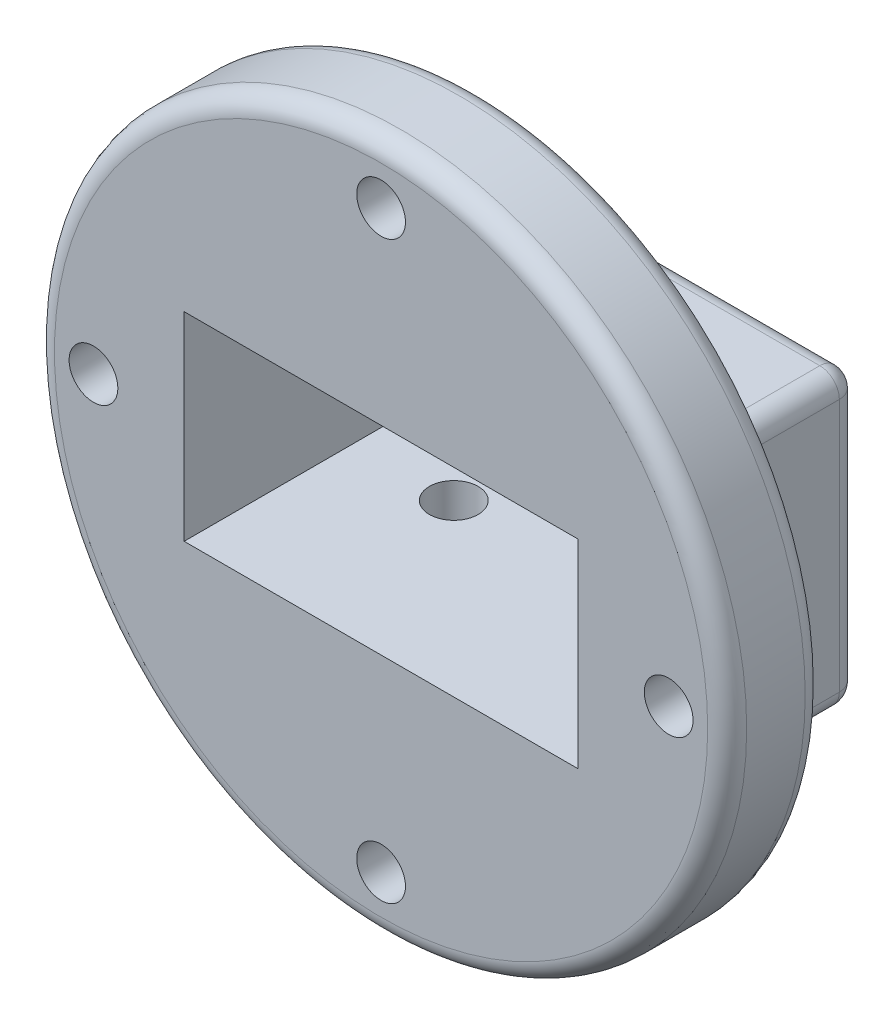
from build123d import *

# Parameters (mm, degrees)
SKETCH_1_R          = 35.5
SKETCH_1_W          = 40.4
SKETCH_1_H          = 20.4
SKETCH_1_R_2        = 2.5
EXTRUDE_1_DEPTH     = 10
EXTRUDE_2_DEPTH     = 15
FILLET_1_R          = 2
SKETCH_3_R          = 2.5
CUT_EXTRUDE_1_DEPTH = 64.525585397
FILLET_2_R          = 2


with BuildPart() as part:
    # 草图1 → 凸台-拉伸1 (new body)
    with BuildSketch(Plane.XY):
        Circle(SKETCH_1_R)
        Rectangle(SKETCH_1_W, SKETCH_1_H, mode=Mode.SUBTRACT)
        with Locations((29.5, 0)):
            Circle(SKETCH_1_R_2, mode=Mode.SUBTRACT)
        with Locations((0, 29.5)):
            Circle(SKETCH_1_R_2, mode=Mode.SUBTRACT)
        with Locations((-29.5, 0)):
            Circle(SKETCH_1_R_2, mode=Mode.SUBTRACT)
        with Locations((0, -29.5)):
            Circle(SKETCH_1_R_2, mode=Mode.SUBTRACT)
    extrude(amount=EXTRUDE_1_DEPTH)

    # 草图1<5> → 凸台-拉伸2 (add)
    # profile 1 of 3: a face of its own
    with BuildSketch(Plane.XY):
        with BuildLine():
            Line((18.090052515, 15), (0, 15))
            Line((0, 15), (-18.090052515, 15))
            ThreePointArc((-18.090052515, 15), (-23.5, 0), (-18.090052515, -15))
            Line((-18.090052515, -15), (18.090052515, -15))
            ThreePointArc((18.090052515, -15), (22.106178255, -7.97288423), (23.5, 0))
            ThreePointArc((23.5, 0), (22.106178255, 7.97288423), (18.090052515, 15))
        make_face()
        Polygon((-20.2, -10.2), (-20.2, 0), (-20.2, 10.2), (0, 10.2), (20.2, 10.2), (20.2, 0), (20.2, -10.2), align=None, mode=Mode.SUBTRACT)
    # profile 2 of 3: a face of its own
    with BuildSketch(Plane.XY):
        with BuildLine():
            Line((24, 15), (18.090052515, 15))
            ThreePointArc((18.090052515, 15), (22.106178255, 7.97288423), (23.5, 0))
            ThreePointArc((23.5, 0), (22.106178255, -7.97288423), (18.090052515, -15))
            Line((18.090052515, -15), (24, -15))
            Line((24, -15), (24, 15))
        make_face()
    # profile 3 of 3: a face of its own
    with BuildSketch(Plane.XY):
        with BuildLine():
            ThreePointArc((-18.090052515, -15), (-23.5, 0), (-18.090052515, 15))
            Line((-18.090052515, 15), (-24, 15))
            Line((-24, 15), (-24, -15))
            Line((-24, -15), (-18.090052515, -15))
        make_face()
    extrude(amount=-EXTRUDE_2_DEPTH)

    # 圆角1
    # the kernel refuses this fillet: 2 mm, written as the material it takes off along each edge
    with BuildSketch(Plane(origin=(-22, 13, -13), x_dir=(0, 1, 0), z_dir=(-1, 0, 0))) as fillet_1_piece_1_section:
        Polygon((0, 0), (FILLET_1_R, 0), (FILLET_1_R, FILLET_1_R), (0, FILLET_1_R), align=None)
    fillet_1_piece_1 = extrude(amount=FILLET_1_R, mode=Mode.PRIVATE)
    fillet_1_piece_1 = fillet_1_piece_1 - Plane(origin=(-22, 13, -13), x_dir=(0, -0.7071067811865475, 0.7071067811865475), z_dir=(-1, 0, 0)) * Sphere(FILLET_1_R, mode=Mode.PRIVATE)
    add(fillet_1_piece_1, mode=Mode.SUBTRACT)
    with BuildSketch(Plane(origin=(22, 13, -13), x_dir=(1, 0, 0), z_dir=(0, 1, 0))) as fillet_1_piece_2_section:
        Polygon((0, 0), (FILLET_1_R, 0), (FILLET_1_R, FILLET_1_R), (0, FILLET_1_R), align=None)
    fillet_1_piece_2 = extrude(amount=FILLET_1_R, mode=Mode.PRIVATE)
    fillet_1_piece_2 = fillet_1_piece_2 - Plane(origin=(22, 13, -13), x_dir=(-0.7071067811865475, 0, 0.7071067811865475), z_dir=(0, 1, 0)) * Sphere(FILLET_1_R, mode=Mode.PRIVATE)
    add(fillet_1_piece_2, mode=Mode.SUBTRACT)
    with BuildSketch(Plane(origin=(22, -13, -13), x_dir=(0, -1, 0), z_dir=(1, 0, 0))) as fillet_1_piece_3_section:
        Polygon((0, 0), (FILLET_1_R, 0), (FILLET_1_R, FILLET_1_R), (0, FILLET_1_R), align=None)
    fillet_1_piece_3 = extrude(amount=FILLET_1_R, mode=Mode.PRIVATE)
    fillet_1_piece_3 = fillet_1_piece_3 - Plane(origin=(22, -13, -13), x_dir=(0, 0.7071067811865475, 0.7071067811865475), z_dir=(1, 0, 0)) * Sphere(FILLET_1_R, mode=Mode.PRIVATE)
    add(fillet_1_piece_3, mode=Mode.SUBTRACT)
    with BuildSketch(Plane(origin=(-22, -13, -13), x_dir=(0, -1, 0), z_dir=(-1, 0, 0))) as fillet_1_piece_4_section:
        Polygon((0, 0), (FILLET_1_R, 0), (FILLET_1_R, -FILLET_1_R), (0, -FILLET_1_R), align=None)
    fillet_1_piece_4 = extrude(amount=FILLET_1_R, mode=Mode.PRIVATE)
    fillet_1_piece_4 = fillet_1_piece_4 - Plane(origin=(-22, -13, -13), x_dir=(0, 0.7071067811865475, 0.7071067811865475), z_dir=(-1, 0, 0)) * Sphere(FILLET_1_R, mode=Mode.PRIVATE)
    add(fillet_1_piece_4, mode=Mode.SUBTRACT)
    with BuildSketch(Plane(origin=(-24, 15, 0), x_dir=(0, -1, 0), z_dir=(0, 0, -1)), Plane(origin=(24, 15, 0), x_dir=(-1, 0, 0), z_dir=(0, 0, -1)), Plane(origin=(24, -15, 0), x_dir=(0, 1, 0), z_dir=(0, 0, -1))) as fillet_1_piece_5:
        with BuildLine():
            CenterArc((FILLET_1_R, -FILLET_1_R), FILLET_1_R, 90, 90)
            Line((0, -FILLET_1_R), (0, 0))
            Line((0, 0), (FILLET_1_R, 0))
        make_face()
    extrude(amount=13, mode=Mode.SUBTRACT)
    with BuildSketch(Plane(origin=(20.2, -10.2, -15), x_dir=(0, -1, 0), z_dir=(-1, 0, 0)), Plane(origin=(-20.2, 10.2, -15), x_dir=(0, 1, 0), z_dir=(1, 0, 0))) as fillet_1_piece_6:
        with BuildLine():
            CenterArc((FILLET_1_R, FILLET_1_R), FILLET_1_R, 180, 90)
            Line((0, FILLET_1_R), (0, 0))
            Line((0, 0), (FILLET_1_R, 0))
        make_face()
    extrude(amount=40.4, mode=Mode.SUBTRACT)
    with BuildSketch(Plane(origin=(20.2, 10.2, -15), x_dir=(1, 0, 0), z_dir=(0, -1, 0))) as fillet_1_piece_7:
        with BuildLine():
            CenterArc((FILLET_1_R, FILLET_1_R), FILLET_1_R, 180, 90)
            Line((0, FILLET_1_R), (0, 0))
            Line((0, 0), (FILLET_1_R, 0))
        make_face()
    extrude(amount=20.4, mode=Mode.SUBTRACT)
    with BuildSketch(Plane(origin=(-20.2, -10.2, -15), x_dir=(0, 0, 1), z_dir=(0, 1, 0))) as fillet_1_piece_8:
        with BuildLine():
            CenterArc((FILLET_1_R, -FILLET_1_R), FILLET_1_R, 90, 90)
            Line((0, -FILLET_1_R), (0, 0))
            Line((0, 0), (FILLET_1_R, 0))
        make_face()
    extrude(amount=20.4, mode=Mode.SUBTRACT)
    with BuildSketch(Plane(origin=(-24, -15, 0), x_dir=(0, 1, 0), z_dir=(0, 0, -1))) as fillet_1_piece_9:
        with BuildLine():
            CenterArc((FILLET_1_R, FILLET_1_R), FILLET_1_R, 180, 90)
            Line((0, FILLET_1_R), (0, 0))
            Line((0, 0), (FILLET_1_R, 0))
        make_face()
    extrude(amount=13, mode=Mode.SUBTRACT)
    with BuildSketch(Plane(origin=(22, 15, -15), x_dir=(0, -1, 0), z_dir=(-1, 0, 0))) as fillet_1_piece_10:
        with BuildLine():
            CenterArc((FILLET_1_R, FILLET_1_R), FILLET_1_R, 180, 90)
            Line((0, FILLET_1_R), (0, 0))
            Line((0, 0), (FILLET_1_R, 0))
        make_face()
    extrude(amount=44, mode=Mode.SUBTRACT)
    with BuildSketch(Plane(origin=(24, -13, -15), x_dir=(-1, 0, 0), z_dir=(0, 1, 0)), Plane(origin=(-24, 13, -15), x_dir=(1, 0, 0), z_dir=(0, -1, 0))) as fillet_1_piece_11:
        with BuildLine():
            CenterArc((FILLET_1_R, FILLET_1_R), FILLET_1_R, 180, 90)
            Line((0, FILLET_1_R), (0, 0))
            Line((0, 0), (FILLET_1_R, 0))
        make_face()
    extrude(amount=26, mode=Mode.SUBTRACT)
    with BuildSketch(Plane(origin=(22, -15, -15), x_dir=(0, 1, 0), z_dir=(-1, 0, 0))) as fillet_1_piece_12:
        with BuildLine():
            CenterArc((FILLET_1_R, -FILLET_1_R), FILLET_1_R, 90, 90)
            Line((0, -FILLET_1_R), (0, 0))
            Line((0, 0), (FILLET_1_R, 0))
        make_face()
    extrude(amount=44, mode=Mode.SUBTRACT)
    with BuildSketch(Plane(origin=(25.2, -10.2, -15), x_dir=(0, -1, 0), z_dir=(-1, 0, 0))) as fillet_1_piece_13a_section:
        with BuildLine():
            CenterArc((FILLET_1_R, FILLET_1_R), FILLET_1_R, 180, 90)
            Line((0, FILLET_1_R), (0, 0))
            Line((0, 0), (FILLET_1_R, 0))
        make_face()
    fillet_1_piece_13a = extrude(amount=45.4, mode=Mode.PRIVATE)
    fillet_1_piece_13a = split(fillet_1_piece_13a, bisect_by=Plane(origin=(20.2, -10.652790229, -14.547209771), z_dir=(1, 0, 0)), keep=Keep.TOP, mode=Mode.PRIVATE)
    with BuildSketch(Plane(origin=(20.2, 10.2, -15), x_dir=(1, 0, 0), z_dir=(0, -1, 0))) as fillet_1_piece_13b_section:
        with BuildLine():
            CenterArc((FILLET_1_R, FILLET_1_R), FILLET_1_R, 180, 90)
            Line((0, FILLET_1_R), (0, 0))
            Line((0, 0), (FILLET_1_R, 0))
        make_face()
    fillet_1_piece_13b = extrude(amount=25.4, mode=Mode.PRIVATE)
    fillet_1_piece_13b = split(fillet_1_piece_13b, bisect_by=Plane(origin=(20.652790229, -10.2, -14.547209771), z_dir=(0, -1, 0)), keep=Keep.TOP, mode=Mode.PRIVATE)
    fillet_1_piece_13 = fillet_1_piece_13a & fillet_1_piece_13b
    add(fillet_1_piece_13, mode=Mode.SUBTRACT)
    with BuildSketch(Plane(origin=(-20.2, -15.2, -15), x_dir=(0, 0, 1), z_dir=(0, 1, 0))) as fillet_1_piece_14a_section:
        with BuildLine():
            CenterArc((FILLET_1_R, -FILLET_1_R), FILLET_1_R, 90, 90)
            Line((0, -FILLET_1_R), (0, 0))
            Line((0, 0), (FILLET_1_R, 0))
        make_face()
    fillet_1_piece_14a = extrude(amount=25.4, mode=Mode.PRIVATE)
    fillet_1_piece_14a = split(fillet_1_piece_14a, bisect_by=Plane(origin=(-20.652790229, -10.2, -14.547209771), z_dir=(0, -1, 0)), keep=Keep.TOP, mode=Mode.PRIVATE)
    with BuildSketch(Plane(origin=(20.2, -10.2, -15), x_dir=(0, -1, 0), z_dir=(-1, 0, 0))) as fillet_1_piece_14b_section:
        with BuildLine():
            CenterArc((FILLET_1_R, FILLET_1_R), FILLET_1_R, 180, 90)
            Line((0, FILLET_1_R), (0, 0))
            Line((0, 0), (FILLET_1_R, 0))
        make_face()
    fillet_1_piece_14b = extrude(amount=45.4, mode=Mode.PRIVATE)
    fillet_1_piece_14b = split(fillet_1_piece_14b, bisect_by=Plane(origin=(-20.2, -10.652790229, -14.547209771), z_dir=(-1, 0, 0)), keep=Keep.TOP, mode=Mode.PRIVATE)
    fillet_1_piece_14 = fillet_1_piece_14a & fillet_1_piece_14b
    add(fillet_1_piece_14, mode=Mode.SUBTRACT)
    with BuildSketch(Plane(origin=(-20.2, 10.2, -15), x_dir=(0, 1, 0), z_dir=(1, 0, 0))) as fillet_1_piece_15a_section:
        with BuildLine():
            CenterArc((FILLET_1_R, FILLET_1_R), FILLET_1_R, 180, 90)
            Line((0, FILLET_1_R), (0, 0))
            Line((0, 0), (FILLET_1_R, 0))
        make_face()
    fillet_1_piece_15a = extrude(amount=45.4, mode=Mode.PRIVATE)
    fillet_1_piece_15a = split(fillet_1_piece_15a, bisect_by=Plane(origin=(20.2, 10.652790229, -14.547209771), z_dir=(1, 0, 0)), keep=Keep.TOP, mode=Mode.PRIVATE)
    with BuildSketch(Plane(origin=(20.2, 15.2, -15), x_dir=(1, 0, 0), z_dir=(0, -1, 0))) as fillet_1_piece_15b_section:
        with BuildLine():
            CenterArc((FILLET_1_R, FILLET_1_R), FILLET_1_R, 180, 90)
            Line((0, FILLET_1_R), (0, 0))
            Line((0, 0), (FILLET_1_R, 0))
        make_face()
    fillet_1_piece_15b = extrude(amount=25.4, mode=Mode.PRIVATE)
    fillet_1_piece_15b = split(fillet_1_piece_15b, bisect_by=Plane(origin=(20.652790229, 10.2, -14.547209771), z_dir=(0, 1, 0)), keep=Keep.TOP, mode=Mode.PRIVATE)
    fillet_1_piece_15 = fillet_1_piece_15a & fillet_1_piece_15b
    add(fillet_1_piece_15, mode=Mode.SUBTRACT)
    with BuildSketch(Plane(origin=(-20.2, -10.2, -15), x_dir=(0, 0, 1), z_dir=(0, 1, 0))) as fillet_1_piece_16a_section:
        with BuildLine():
            CenterArc((FILLET_1_R, -FILLET_1_R), FILLET_1_R, 90, 90)
            Line((0, -FILLET_1_R), (0, 0))
            Line((0, 0), (FILLET_1_R, 0))
        make_face()
    fillet_1_piece_16a = extrude(amount=25.4, mode=Mode.PRIVATE)
    fillet_1_piece_16a = split(fillet_1_piece_16a, bisect_by=Plane(origin=(-20.652790229, 10.2, -14.547209771), z_dir=(0, 1, 0)), keep=Keep.TOP, mode=Mode.PRIVATE)
    with BuildSketch(Plane(origin=(-25.2, 10.2, -15), x_dir=(0, 1, 0), z_dir=(1, 0, 0))) as fillet_1_piece_16b_section:
        with BuildLine():
            CenterArc((FILLET_1_R, FILLET_1_R), FILLET_1_R, 180, 90)
            Line((0, FILLET_1_R), (0, 0))
            Line((0, 0), (FILLET_1_R, 0))
        make_face()
    fillet_1_piece_16b = extrude(amount=45.4, mode=Mode.PRIVATE)
    fillet_1_piece_16b = split(fillet_1_piece_16b, bisect_by=Plane(origin=(-20.2, 10.652790229, -14.547209771), z_dir=(-1, 0, 0)), keep=Keep.TOP, mode=Mode.PRIVATE)
    fillet_1_piece_16 = fillet_1_piece_16a & fillet_1_piece_16b
    add(fillet_1_piece_16, mode=Mode.SUBTRACT)
    # the kernel refuses this fillet: 2 mm, written as the material it adds along each edge
    with BuildSketch(Plane(origin=(-22, 15, 0), x_dir=(0, 0, -1), z_dir=(1, 0, 0))) as fillet_1_2_piece_1:
        with BuildLine():
            CenterArc((FILLET_1_R, FILLET_1_R), FILLET_1_R, 180, 90)
            Line((0, FILLET_1_R), (0, 0))
            Line((0, 0), (FILLET_1_R, 0))
        make_face()
    extrude(amount=44)
    with BuildSketch(Plane(origin=(24, -13, 0), x_dir=(0, 0, -1), z_dir=(0, 1, 0)), Plane(origin=(-24, 13, 0), x_dir=(0, 0, -1), z_dir=(0, -1, 0))) as fillet_1_2_piece_2:
        with BuildLine():
            CenterArc((FILLET_1_R, -FILLET_1_R), FILLET_1_R, 90, 90)
            Line((0, -FILLET_1_R), (0, 0))
            Line((0, 0), (FILLET_1_R, 0))
        make_face()
    extrude(amount=26)
    with BuildSketch(Plane(origin=(-22, -15, 0), x_dir=(0, 0, -1), z_dir=(1, 0, 0))) as fillet_1_2_piece_3:
        with BuildLine():
            CenterArc((FILLET_1_R, -FILLET_1_R), FILLET_1_R, 90, 90)
            Line((0, -FILLET_1_R), (0, 0))
            Line((0, 0), (FILLET_1_R, 0))
        make_face()
    extrude(amount=44)
    with BuildSketch(Plane(origin=(-22, 13, 0), x_dir=(-1, 0, 0), z_dir=(0, -1, 0))) as fillet_1_2_piece_4:
        with BuildLine():
            CenterArc((2 + FILLET_1_R, FILLET_1_R), FILLET_1_R, 180, 90)
            Line((2 + FILLET_1_R, 0), (2, 0))
            Line((2, 0), (2, FILLET_1_R))
        make_face()
    revolve(axis=Axis((-22, 13, 0), (0, 0, -1)), revolution_arc=90)
    with BuildSketch(Plane(origin=(-22, -13, 0), x_dir=(-1, 0, 0), z_dir=(0, 1, 0))) as fillet_1_2_piece_5:
        with BuildLine():
            CenterArc((2 + FILLET_1_R, -FILLET_1_R), FILLET_1_R, 90, 90)
            Line((2 + FILLET_1_R, 0), (2, 0))
            Line((2, 0), (2, -FILLET_1_R))
        make_face()
    revolve(axis=Axis((-22, -13, 0), (0, 0, 1)), revolution_arc=90)
    with BuildSketch(Plane(origin=(22, -13, 0), x_dir=(1, 0, 0), z_dir=(0, 1, 0))) as fillet_1_2_piece_6:
        with BuildLine():
            CenterArc((2 + FILLET_1_R, FILLET_1_R), FILLET_1_R, 180, 90)
            Line((2 + FILLET_1_R, 0), (2, 0))
            Line((2, 0), (2, FILLET_1_R))
        make_face()
    revolve(axis=Axis((22, -13, 0), (0, 0, -1)), revolution_arc=90)
    with BuildSketch(Plane(origin=(22, 13, 0), x_dir=(0, 1, 0), z_dir=(-1, 0, 0))) as fillet_1_2_piece_7:
        with BuildLine():
            CenterArc((2 + FILLET_1_R, FILLET_1_R), FILLET_1_R, 180, 90)
            Line((2 + FILLET_1_R, 0), (2, 0))
            Line((2, 0), (2, FILLET_1_R))
        make_face()
    revolve(axis=Axis((22, 13, 0), (0, 0, -1)), revolution_arc=90)

    # 草图3 → 切除-拉伸1 (cut, through all)
    with BuildSketch(Plane(origin=(0, 15, 0), x_dir=(1, 0, 0), z_dir=(0, 1, 0))):
        with Locations(Location((10, 7.455811309, 0), (0, 0, 180))):
            Circle(SKETCH_3_R)
        with Locations(Location((-10, 7.455811309, 0), (0, 0, 180))):
            Circle(SKETCH_3_R)
    extrude(amount=-CUT_EXTRUDE_1_DEPTH, mode=Mode.SUBTRACT)

    # 圆角2
    fillet_2_edges = [part.edges().sort_by_distance(p)[0] for p in [
        (-35.5, 0, 0),
        (-35.5, 0, 10),
    ]]
    fillet(fillet_2_edges, radius=FILLET_2_R)


solid = part.part
